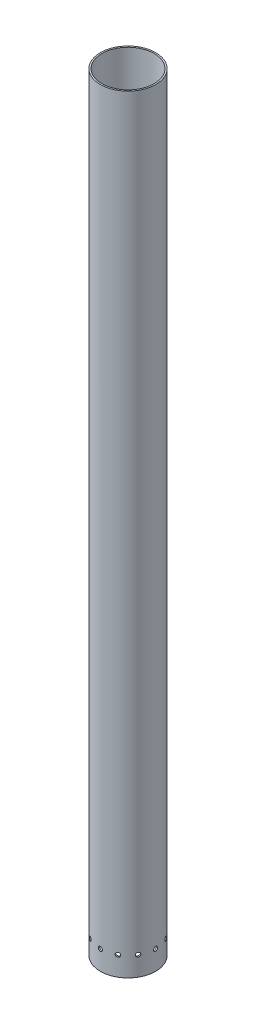
from build123d import *

# Parameters (mm, degrees)
SKETCH1_W         = 1.4732
SKETCH1_H         = 749.3
CIRPATTERN1_COUNT = 12


with BuildPart() as part:
    # Sketch1 → Revolve1 (revolve)
    with BuildSketch(Plane.XY):
        with Locations((26.2509, -322.439188343)):
            Rectangle(SKETCH1_W, SKETCH1_H)
    revolve(axis=Axis((0, 0, 0), (0, 1, 0)))

    # Sketch3 → #10-32 Tapped Hole1 (revolve, cut)
    with BuildSketch(Plane(origin=(0, -678.039188343, -26.9875), x_dir=(0, 1, 0), z_dir=(1, 0, 0))):
        Polygon((0, 0), (0, 15.183317848), (2.0193, 13.97), (2.0193, 0), align=None)
    f_10_32_tapped_hole1 = revolve(axis=Axis((0, -678.039188343, -33.3375), (0, 0, 1)), mode=Mode.SUBTRACT)

    # CirPattern1: #10-32 Tapped Hole1 ×12 about axis
    cirpattern1_axis = Axis((0, 0, 0), (0, -1, 0))
    for i in range(1, CIRPATTERN1_COUNT):
        add(f_10_32_tapped_hole1.rotate(cirpattern1_axis, i * 360 / CIRPATTERN1_COUNT), mode=Mode.SUBTRACT)


solid = part.part
